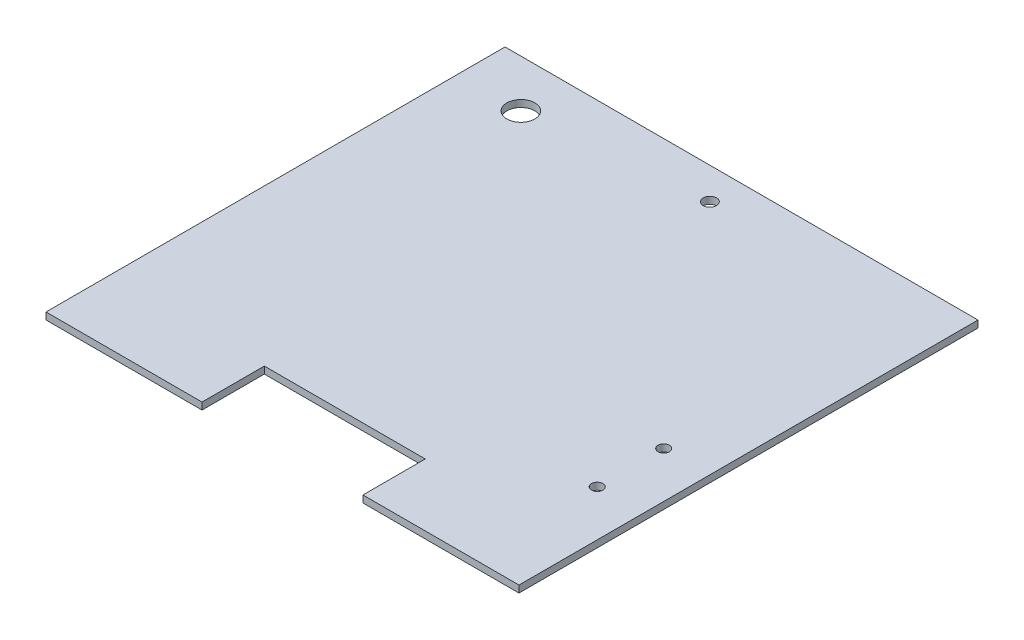
from build123d import *

# Parameters (mm, degrees)
SKETCH1_W           = 189.738
SKETCH1_H           = 184.15
BOSS_EXTRUDE1_DEPTH = 2.794
SKETCH2_R           = 2.6797
CUT_EXTRUDE1_DEPTH  = 133.233653893
CUT_EXTRUDE2_DEPTH  = 133.233653893
SKETCH5_R           = 2.286
SKETCH5_R_2         = 5.6134
CUT_EXTRUDE3_DEPTH  = 133.233653893


with BuildPart() as part:
    # Sketch1 → Boss-Extrude1 (new body)
    with BuildSketch(Plane(origin=(0, 0, 0), x_dir=(1, 0, 0), z_dir=(0, 1, 0))):
        Rectangle(SKETCH1_W, SKETCH1_H)
    extrude(amount=BOSS_EXTRUDE1_DEPTH)

    # Sketch2 → Cut-Extrude1 (cut, through all)
    with BuildSketch(Plane(origin=(0, 2.794, 0), x_dir=(1, 0, 0), z_dir=(0, 1, 0))):
        with Locations((0, 79.375)):
            Circle(SKETCH2_R)
    extrude(amount=-CUT_EXTRUDE1_DEPTH, mode=Mode.SUBTRACT)

    # Sketch3 → Cut-Extrude2 (cut, through all)
    with BuildSketch(Plane(origin=(0, 2.794, 0), x_dir=(1, 0, 0), z_dir=(0, 1, 0))):
        Polygon((0, -92.075), (-32.28, -92.075), (-32.28, -67.074999962), (32.28, -67.074999962), (32.28, -92.075), align=None)
    extrude(amount=-CUT_EXTRUDE2_DEPTH, mode=Mode.SUBTRACT)

    # Sketch5 → Cut-Extrude3 (cut, through all)
    with BuildSketch(Plane(origin=(0, 2.794, 0), x_dir=(1, 0, 0), z_dir=(0, 1, 0))):
        with Locations((76.454, -15.59599)):
            Circle(SKETCH5_R)
        with Locations((76.454, -42.26599)):
            Circle(SKETCH5_R)
        with Locations((-69.469, 73.025)):
            Circle(SKETCH5_R_2)
    extrude(amount=-CUT_EXTRUDE3_DEPTH, mode=Mode.SUBTRACT)


solid = part.part
